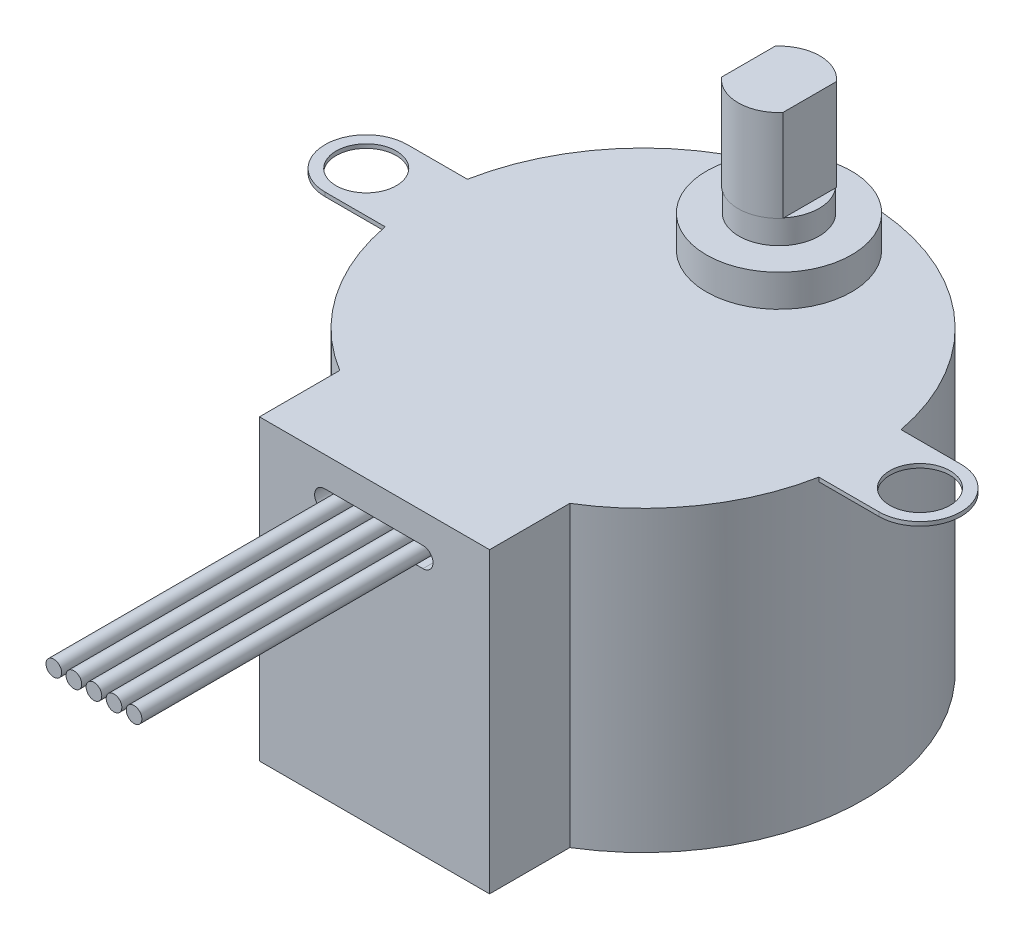
from build123d import *

# Parameters (mm, degrees)
BOSS_EXTRUDE1_DEPTH = 18.8722
SKETCH3_R           = 4.5974
SKETCH3_R_2         = 2.54
BOSS_EXTRUDE2_DEPTH = 2.032
SKETCH3_2_R         = 4.5974
SKETCH3_2_R_2       = 2.54
BOSS_EXTRUDE3_DEPTH = 2.032
SKETCH4_R           = 2.54
BOSS_EXTRUDE4_DEPTH = 3.556
BOSS_EXTRUDE5_DEPTH = 5.8039
CUT_EXTRUDE1_DEPTH  = 7.62
SKETCH7_R           = 0.4953
BOSS_EXTRUDE6_DEPTH = 25.4
SKETCH8_R           = 1.905
BOSS_EXTRUDE7_DEPTH = 0.254


with BuildPart() as part:
    # Sketch1 → Boss-Extrude1 (new body)
    with BuildSketch(Plane(origin=(0, 0, 0), x_dir=(1, 0, 0), z_dir=(0, 1, 0))):
        with BuildLine():
            Line((-7.28345, -11.921084519), (-7.28345, -17.001084519))
            Line((-7.28345, -17.001084519), (7.28345, -17.001084519))
            Line((7.28345, -17.001084519), (7.28345, -11.921084519))
            ThreePointArc((7.28345, -11.921084519), (0, 13.97), (-7.28345, -11.921084519))
        make_face()
    extrude(amount=BOSS_EXTRUDE1_DEPTH)

    # Sketch3 → Boss-Extrude2 (add)
    with BuildSketch(Plane(origin=(0, 18.8722, 0), x_dir=(1, 0, 0), z_dir=(0, 1, 0))):
        with Locations((0.01905, 8.585233697)):
            Circle(SKETCH3_R)
        with Locations((0.01905, 8.585233697)):
            Circle(SKETCH3_R_2, mode=Mode.SUBTRACT)
    extrude(amount=BOSS_EXTRUDE2_DEPTH)

    # Sketch3<2> → Boss-Extrude3 (add)
    with BuildSketch(Plane(origin=(0, 18.8722, 0), x_dir=(1, 0, 0), z_dir=(0, 1, 0))):
        with Locations((0.01905, 8.585233697)):
            Circle(SKETCH3_2_R)
        with Locations((0.01905, 8.585233697)):
            Circle(SKETCH3_2_R_2, mode=Mode.SUBTRACT)
    extrude(amount=BOSS_EXTRUDE3_DEPTH)

    # Sketch4 → Boss-Extrude4 (add)
    with BuildSketch(Plane(origin=(0, 18.8722, 0), x_dir=(1, 0, 0), z_dir=(0, 1, 0))):
        with Locations((0.01905, 8.585233697)):
            Circle(SKETCH4_R)
    extrude(amount=BOSS_EXTRUDE4_DEPTH)

    # Sketch5 → Boss-Extrude5 (add)
    with BuildSketch(Plane(origin=(0, 22.4282, 0), x_dir=(1, 0, 0), z_dir=(0, 1, 0))):
        with BuildLine():
            Line((-1.921484266, 10.287033697), (-1.921484266, 6.883433697))
            ThreePointArc((-1.921484266, 6.883433697), (0.01905, 6.00418808), (1.959584266, 6.883433697))
            Line((1.959584266, 6.883433697), (1.959584266, 10.287033697))
            ThreePointArc((1.959584266, 10.287033697), (0.01905, 11.166279314), (-1.921484266, 10.287033697))
        make_face()
    extrude(amount=BOSS_EXTRUDE5_DEPTH)

    # Sketch6 → Cut-Extrude1 (cut)
    with BuildSketch(Plane.XY.offset(17.001084519)):
        with BuildLine():
            Line((-3.15595, 16.994300905), (3.06705, 16.994300905))
            ThreePointArc((3.06705, 16.994300905), (3.70205, 16.359300905), (3.06705, 15.724300905))
            Line((3.06705, 15.724300905), (-3.15595, 15.724300905))
            ThreePointArc((-3.15595, 15.724300905), (-3.79095, 16.359300905), (-3.15595, 16.994300905))
        make_face()
    extrude(amount=-CUT_EXTRUDE1_DEPTH, mode=Mode.SUBTRACT)

    # Sketch7 → Boss-Extrude6 (add)
    with BuildSketch(Plane.XY.offset(9.381084519)):
        with Locations((-2.52095, 16.363108556)):
            Circle(SKETCH7_R)
        with Locations((-1.25095, 16.363108556)):
            Circle(SKETCH7_R)
        with Locations((0.01905, 16.363108556)):
            Circle(SKETCH7_R)
        with Locations((1.28905, 16.363108556)):
            Circle(SKETCH7_R)
        with Locations((2.55905, 16.363108556)):
            Circle(SKETCH7_R)
    extrude(amount=BOSS_EXTRUDE6_DEPTH)

    # Sketch8 → Boss-Extrude7 (add)
    with BuildSketch(Plane(origin=(0, 18.8722, 0), x_dir=(1, 0, 0), z_dir=(0, 1, 0))):
        with BuildLine():
            Line((-17.526, 2.603152897), (17.526, 2.603152897))
            ThreePointArc((17.526, 2.603152897), (20.129152897, 0), (17.526, -2.603152897))
            Line((17.526, -2.603152897), (-17.526, -2.603152897))
            ThreePointArc((-17.526, -2.603152897), (-20.129152897, 0), (-17.526, 2.603152897))
        make_face()
        with Locations((-17.526, 0)):
            Circle(SKETCH8_R, mode=Mode.SUBTRACT)
        with Locations((17.526, 0)):
            Circle(SKETCH8_R, mode=Mode.SUBTRACT)
    extrude(amount=-BOSS_EXTRUDE7_DEPTH)


solid = part.part
